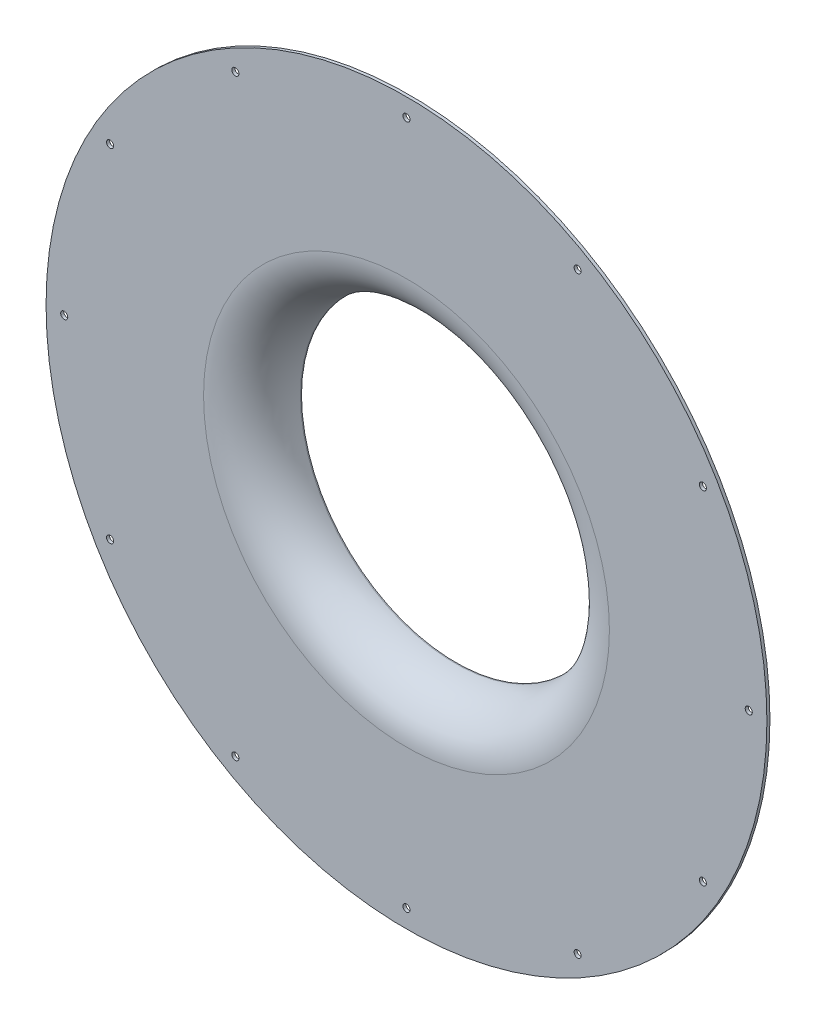
from build123d import *

# Parameters (mm, degrees)
SKETCH1_R          = 357
BASE_FLANGE1_DEPTH = 3
SKETCH2_R          = 156
CUT_EXTRUDE1_DEPTH = 10
CIRPATTERN1_COUNT  = 12


# Read off the part's stored shape, not the designer's step: Edge-Flange1
# Sheet-metal steps are written as plain solids
with BuildPart() as part:
    # Sketch1 → Base-Flange1 (new body)
    with BuildSketch(Plane.XY):
        Circle(SKETCH1_R)
    extrude(amount=-BASE_FLANGE1_DEPTH)

    # Sketch2 → Cut-Extrude1 (cut)
    with BuildSketch(Plane(origin=(0, 0, -3), x_dir=(-1, 0, 0), z_dir=(0, 0, -1))):
        Circle(SKETCH2_R)
    extrude(amount=-CUT_EXTRUDE1_DEPTH, mode=Mode.SUBTRACT)

    # Edge-Flange1 outline → Edge-Flange1 (revolve, cut)
    with BuildSketch(Plane.XZ):
        with BuildLine():
            Line((156, -3), (184.296706911, -3))
            ThreePointArc((184.296706911, -3), (192.514718626, -0.755952756), (201, 0))
            Line((201, 0), (156, 0))
            Line((156, 0), (156, -3))
        make_face()
    revolve(axis=Axis((0, 0, 0), (0, 0, 1)), mode=Mode.SUBTRACT)

    # Edge-Flange1 2 outline → Edge-Flange1 2 (revolve)
    with BuildSketch(Plane.XZ):
        with BuildLine():
            Line((153, -48), (153, -49))
            Line((153, -49), (156, -49))
            Line((156, -49), (156, -48))
            ThreePointArc((156, -48), (169.180194847, -16.180194847), (201, -3))
            Line((201, -3), (184.296706911, -3))
            ThreePointArc((184.296706911, -3), (161.593413823, -20.593413823), (153, -48))
        make_face()
    revolve(axis=Axis((0, 0, 0), (0, 0, 1)))

    # Sketch10 → M8x1.0 Tapped Hole1 (revolve, cut)
    with BuildSketch(Plane(origin=(-339, 0, -3), x_dir=(0, 1, 0), z_dir=(1, 0, 0))):
        Polygon((0, 0), (0, 21.103012167), (3.5, 19), (3.5, 0), align=None)
    m8x1_0_tapped_hole1 = revolve(axis=Axis((-339, 0, -9.35), (0, 0, 1)), mode=Mode.SUBTRACT)

    # CirPattern1: M8x1.0 Tapped Hole1 ×12 about axis
    cirpattern1_axis = Axis((0, 0, 0), (0, 0, 1))
    for i in range(1, CIRPATTERN1_COUNT):
        add(m8x1_0_tapped_hole1.rotate(cirpattern1_axis, i * 360 / CIRPATTERN1_COUNT), mode=Mode.SUBTRACT)


solid = part.part
